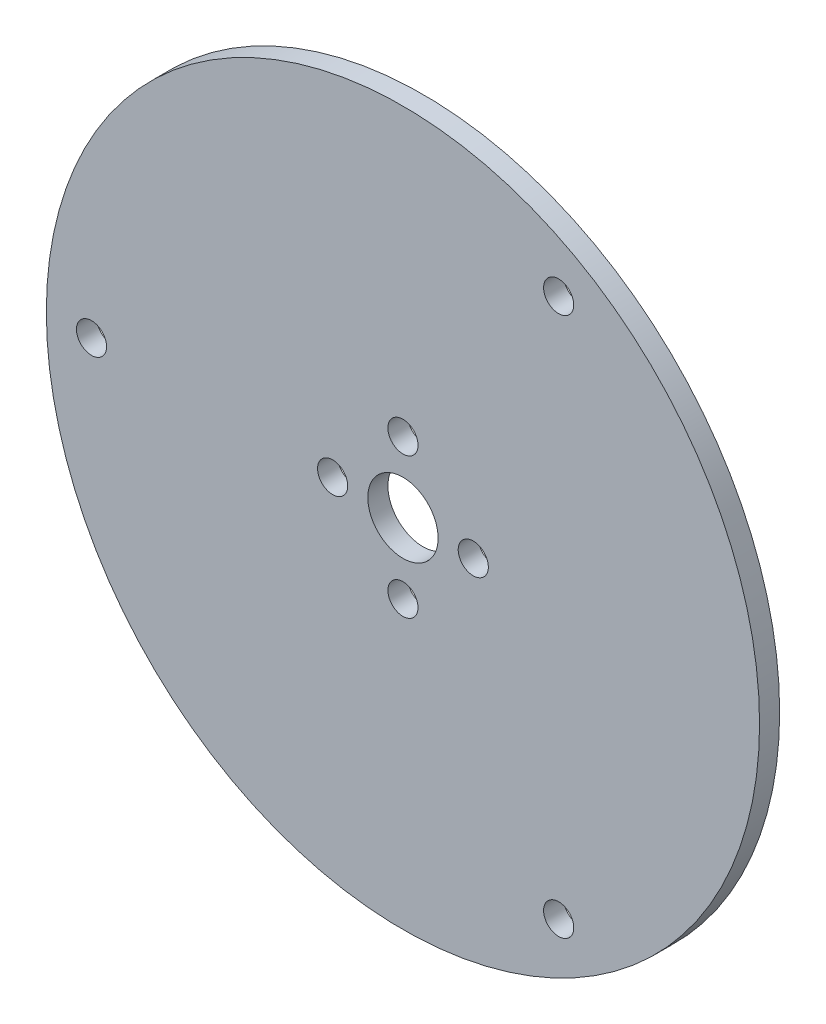
from build123d import *

# Parameters (mm, degrees)
SKETCH_1_R          = 35.5
EXTRUDE_1_DEPTH     = 2
SKETCH_2_R          = 3.5
CUT_EXTRUDE_1_DEPTH = 2
SKETCH_3_R          = 1.5
CUT_EXTRUDE_2_DEPTH = 2
SKETCH_5_R          = 1.5
CUT_EXTRUDE_3_DEPTH = 2


with BuildPart() as part:
    # 草图1 → 凸台-拉伸1 (new body)
    with BuildSketch(Plane.XY):
        Circle(SKETCH_1_R)
    extrude(amount=EXTRUDE_1_DEPTH)

    # 草图2 → 切除-拉伸1 (cut)
    with BuildSketch(Plane.XY.offset(2)):
        Circle(SKETCH_2_R)
    extrude(amount=-CUT_EXTRUDE_1_DEPTH, mode=Mode.SUBTRACT)

    # 草图3 → 切除-拉伸2 (cut)
    with BuildSketch(Plane.XY.offset(2)):
        with Locations((0, 7)):
            Circle(SKETCH_3_R)
        with Locations((7, 0)):
            Circle(SKETCH_3_R)
        with Locations((0, -7)):
            Circle(SKETCH_3_R)
        with Locations((-7, 0)):
            Circle(SKETCH_3_R)
    extrude(amount=-CUT_EXTRUDE_2_DEPTH, mode=Mode.SUBTRACT)

    # 草图5 → 切除-拉伸3 (cut)
    with BuildSketch(Plane.XY.offset(2)):
        with Locations((-31, 0)):
            Circle(SKETCH_5_R)
        with Locations((15.5, 26.846787517)):
            Circle(SKETCH_5_R)
        with Locations((15.5, -26.846787517)):
            Circle(SKETCH_5_R)
    extrude(amount=-CUT_EXTRUDE_3_DEPTH, mode=Mode.SUBTRACT)


solid = part.part
